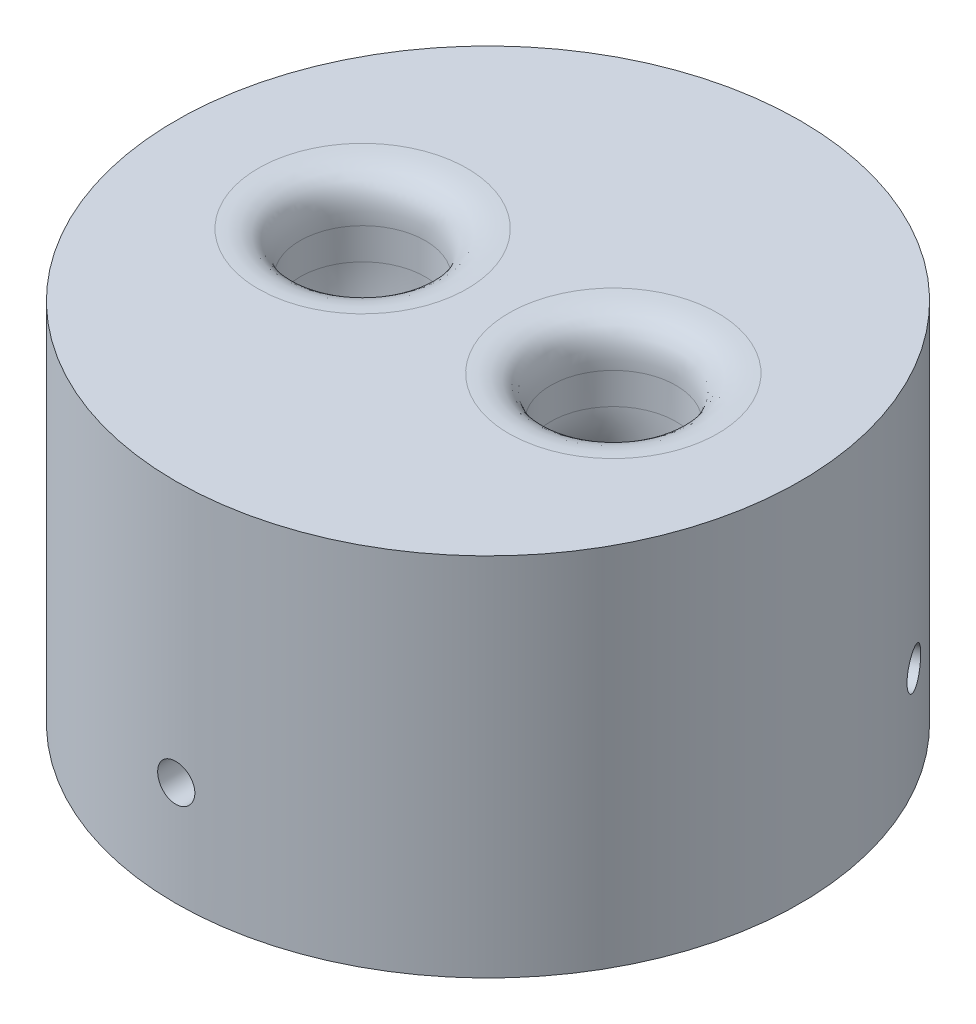
from build123d import *

# Parameters (mm, degrees)
SKETCH1_R           = 18.9865
BOSS_EXTRUDE1_DEPTH = 17.78
SKETCH2_R           = 3.81
SKETCH3_R           = 18.9865
SKETCH3_R_2         = 3.81
BOSS_EXTRUDE2_DEPTH = 4.445
FILLET1_SIZE        = 2.54
CIRPATTERN1_COUNT   = 3


with BuildPart() as part:
    # Sketch1 → Boss-Extrude1 (new body)
    with BuildSketch(Plane(origin=(0, 0, 0), x_dir=(1, 0, 0), z_dir=(0, 1, 0))):
        with Locations(Location((0, 0, 0), (0, 0, 270))):
            Circle(SKETCH1_R)
    extrude(amount=BOSS_EXTRUDE1_DEPTH)

    # Sketch2 → Cut-Revolve1 (revolve, cut)
    with BuildSketch(Plane(origin=(0, 17.78, 0), x_dir=(1, 0, 0), z_dir=(0, 1, 0)), mode=Mode.PRIVATE) as cut_revolve1_sk:
        with Locations((-7.62, 0)):
            Circle(SKETCH2_R)
    revolve(cut_revolve1_sk.sketch.rotate(Axis((0, 17.78, -18.9865), (0, 0, 1)), 90), axis=Axis((0, 17.78, -18.9865), (0, 0, 1)), mode=Mode.SUBTRACT)

    # Sketch3 → Boss-Extrude2 (add)
    with BuildSketch(Plane(origin=(0, 17.78, 0), x_dir=(1, 0, 0), z_dir=(0, 1, 0))):
        with Locations(Location((0, 0, 0), (0, 0, 270))):
            Circle(SKETCH3_R)
        with Locations((7.62, 0)):
            Circle(SKETCH3_R_2, mode=Mode.SUBTRACT)
        with Locations(Location((-7.62, 0, 0), (0, 0, 180))):
            Circle(SKETCH3_R_2, mode=Mode.SUBTRACT)
    extrude(amount=BOSS_EXTRUDE2_DEPTH)

    # Fillet1
    # a fillet whose section is not a circle: 2.54 mm, written as the material it takes off along each edge
    with BuildSketch(Plane(origin=(7.62, 22.225, 0), x_dir=(1, 0, 0), z_dir=(0, 0, 1))) as fillet1_piece_1:
        with BuildLine():
            add(Edge.make_bspline([(3.81 + FILLET1_SIZE, 0), (3.81 + FILLET1_SIZE * 0.831801948466, 0), (3.81 + FILLET1_SIZE * 0.663603896932, 0), (3.81 + FILLET1_SIZE * 0.292893218813, -FILLET1_SIZE * 0.0716919198361), (3.81 + FILLET1_SIZE * 0.0716919198361, -FILLET1_SIZE * 0.292893218813), (3.81, -FILLET1_SIZE * 0.663603896932), (3.81, -FILLET1_SIZE * 0.831801948466), (3.81, -FILLET1_SIZE)], knots=[0, 0, 0, 0, 0, 0, 0.5, 0.5, 1, 1, 1, 1, 1, 1], degree=5))
            Line((3.81, -FILLET1_SIZE), (3.81, 0))
            Line((3.81, 0), (3.81 + FILLET1_SIZE, 0))
        make_face()
    revolve(axis=Axis((7.62, 22.225, 0), (0, 1, 0)), mode=Mode.SUBTRACT)
    with BuildSketch(Plane(origin=(-7.62, 22.225, 0), x_dir=(-1, 0, 0), z_dir=(0, 0, -1))) as fillet1_piece_2:
        with BuildLine():
            add(Edge.make_bspline([(3.81 + FILLET1_SIZE, 0), (3.81 + FILLET1_SIZE * 0.831801948466, 0), (3.81 + FILLET1_SIZE * 0.663603896932, 0), (3.81 + FILLET1_SIZE * 0.292893218813, -FILLET1_SIZE * 0.0716919198361), (3.81 + FILLET1_SIZE * 0.0716919198361, -FILLET1_SIZE * 0.292893218813), (3.81, -FILLET1_SIZE * 0.663603896932), (3.81, -FILLET1_SIZE * 0.831801948466), (3.81, -FILLET1_SIZE)], knots=[0, 0, 0, 0, 0, 0, 0.5, 0.5, 1, 1, 1, 1, 1, 1], degree=5))
            Line((3.81, -FILLET1_SIZE), (3.81, 0))
            Line((3.81, 0), (3.81 + FILLET1_SIZE, 0))
        make_face()
    revolve(axis=Axis((-7.62, 22.225, 0), (0, 1, 0)), mode=Mode.SUBTRACT)

    # Sketch5 → Tap Drill for #4-40 Tap1 (revolve, cut)
    with BuildSketch(Plane(origin=(0, 6.35, 18.9865), x_dir=(0, -1, 0), z_dir=(1, 0, 0))):
        Polygon((0, 0), (0, 10.204152758), (1.1303, 9.525), (1.1303, 0), align=None)
    tap_drill_for_4_40_tap1 = revolve(axis=Axis((0, 6.35, 25.3365), (0, 0, -1)), mode=Mode.SUBTRACT)

    # CirPattern1: Tap Drill for #4-40 Tap1 ×3 about axis
    cirpattern1_axis = Axis((0, 0, 0), (0, -1, 0))
    for i in range(1, CIRPATTERN1_COUNT):
        add(tap_drill_for_4_40_tap1.rotate(cirpattern1_axis, i * 360 / CIRPATTERN1_COUNT), mode=Mode.SUBTRACT)


solid = part.part
